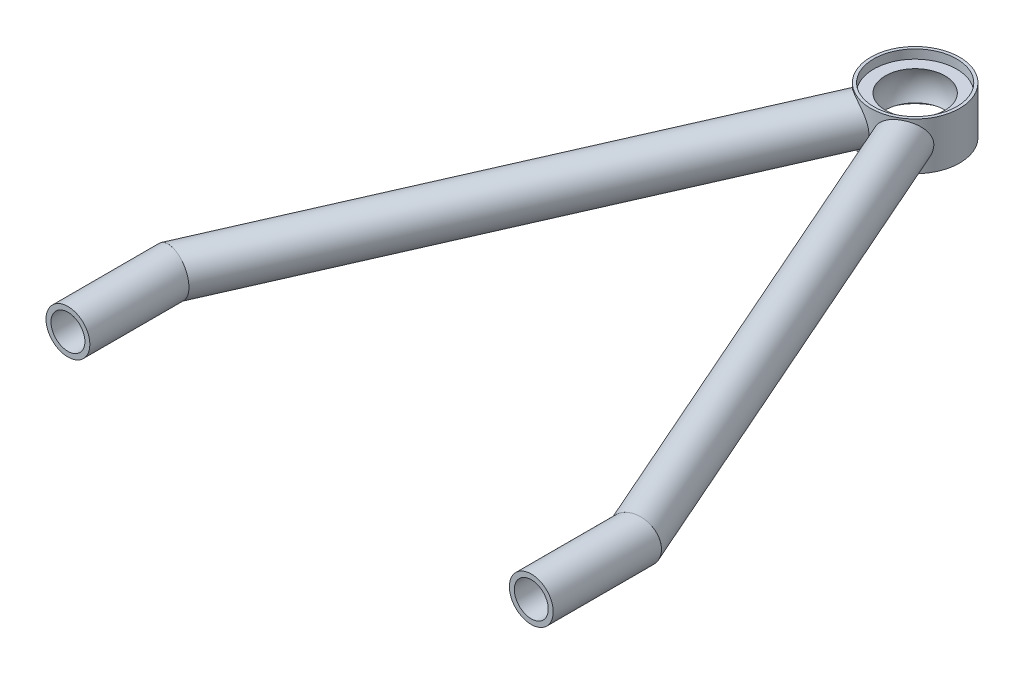
from build123d import *

# Parameters (mm, degrees)
SKETCH1_ON_SEGMENT_1_R                  = 7.4
SKETCH1_ON_SEGMENT_1_R_2                = 5.725
CIRCULAR_TUBE_21_3_X_2_3_1_DEPTH        = 38.202079732
CIRCULAR_TUBE_21_3_X_2_3_1_2_DEPTH      = 178.412650039
CIRCULAR_TUBE_21_3_X_2_3_1_2_DEPTH_BACK = 3.202079732
SKETCH1_R                               = 7.4
SKETCH1_R_2                             = 5.725
SKETCH11_ON_SEGMENT_1_R                 = 7.4
SKETCH11_ON_SEGMENT_1_R_2               = 5.725
CIRCULAR_TUBE_21_3_X_2_3_2_DEPTH        = 38.202079732
CIRCULAR_TUBE_21_3_X_2_3_2_2_DEPTH      = 178.412650039
CIRCULAR_TUBE_21_3_X_2_3_2_2_DEPTH_BACK = 3.202079732
SKETCH11_R                              = 7.4
SKETCH11_R_2                            = 5.725
SKETCH_1_R                              = 15
EXTRUDE_1_DEPTH                         = 8
SKETCH_5_R                              = 14
CUT_EXTRUDE_1_DEPTH                     = 3
SKETCH_7_R                              = 14
CUT_EXTRUDE_2_DEPTH                     = 3
WELD_START                              = -8
WELD_TRIM_4_DEPTH                       = 16
WELD_TRIM_4_2_DEPTH                     = 16


with BuildPart() as part:
    # Sketch1 on segment 1 (carried to segment 1) → Circular tube 21.3 X 2.3(1) (new body)
    with BuildSketch(Plane(origin=(-78.21449332, 0, 195.502886979), x_dir=(-1, 0, 0), z_dir=(0, 0, -1))):
        Circle(SKETCH1_ON_SEGMENT_1_R)
        Circle(SKETCH1_ON_SEGMENT_1_R_2, mode=Mode.SUBTRACT)
    extrude(amount=CIRCULAR_TUBE_21_3_X_2_3_1_DEPTH)

    # Circular tube 21.3 X 2.3(1) mitre 1
    split(bisect_by=Plane(origin=(-78.21449332, 0, 160.502886979), x_dir=(0, -1, 0), z_dir=(-0.205910543, 0, 0.978570819)), keep=Keep.TOP)


with BuildPart() as body_2:
    # Sketch1 → Circular tube 21.3 X 2.3_1 2 (new, two sides: drawn at the far end of the back side and taken through both)
    with BuildSketch(Plane(origin=(-78.21449332, 0, 160.502886979), x_dir=(-0.9152016968098962, 0, -0.4029960969491974), z_dir=(0.4029960969491974, 0, -0.9152016968098962)).offset(-CIRCULAR_TUBE_21_3_X_2_3_1_2_DEPTH_BACK)):
        Circle(SKETCH1_R)
        Circle(SKETCH1_R_2, mode=Mode.SUBTRACT)
    extrude(amount=CIRCULAR_TUBE_21_3_X_2_3_1_2_DEPTH + CIRCULAR_TUBE_21_3_X_2_3_1_2_DEPTH_BACK)

    # Circular tube 21.3 X 2.3_1 2 mitre 1
    split(bisect_by=Plane(origin=(-78.21449332, 0, 160.502886979), x_dir=(0, 1, 0), z_dir=(0.205910543, 0, -0.978570819)), keep=Keep.TOP)


with BuildPart() as body_3:
    # Sketch11 on segment 1 (carried to segment 1) → Circular tube 21.3 X 2.3(2) (new body)
    with BuildSketch(Plane(origin=(78.21449332, 0, 195.502886979), x_dir=(-1, 0, 0), z_dir=(0, 0, -1))):
        Circle(SKETCH11_ON_SEGMENT_1_R)
        Circle(SKETCH11_ON_SEGMENT_1_R_2, mode=Mode.SUBTRACT)
    extrude(amount=CIRCULAR_TUBE_21_3_X_2_3_2_DEPTH)

    # Circular tube 21.3 X 2.3(2) mitre 1
    split(bisect_by=Plane(origin=(78.21449332, 0, 160.502886979), x_dir=(0, -1, 0), z_dir=(0.205910543, 0, 0.978570819)), keep=Keep.TOP)


with BuildPart() as body_4:
    # Sketch11 → Circular tube 21.3 X 2.3_2 2 (new, two sides: drawn at the far end of the back side and taken through both)
    with BuildSketch(Plane(origin=(78.21449332, 0, 160.502886979), x_dir=(-0.9152016968098962, 0, 0.40299609694919775), z_dir=(-0.40299609694919775, 0, -0.9152016968098962)).offset(-CIRCULAR_TUBE_21_3_X_2_3_2_2_DEPTH_BACK)):
        Circle(SKETCH11_R)
        Circle(SKETCH11_R_2, mode=Mode.SUBTRACT)
    extrude(amount=CIRCULAR_TUBE_21_3_X_2_3_2_2_DEPTH + CIRCULAR_TUBE_21_3_X_2_3_2_2_DEPTH_BACK)

    # Circular tube 21.3 X 2.3_2 2 mitre 1
    split(bisect_by=Plane(origin=(78.21449332, 0, 160.502886979), x_dir=(0, 1, 0), z_dir=(-0.205910543, 0, -0.978570819)), keep=Keep.TOP)


with BuildPart() as body_5:
    # 스케치1 → 보스-돌출1 (new, symmetric)
    with BuildSketch(Plane(origin=(0, 0, 0), x_dir=(1, 0, 0), z_dir=(0, 1, 0))):
        with Locations(Location((0, 12.307113021, 0), (0, 0, 270))):
            Circle(SKETCH_1_R)
    extrude(amount=EXTRUDE_1_DEPTH, both=True)


with BuildPart() as cut_extrude_1_tool:
    # 스케치5 → 컷-돌출1 (new body)
    with BuildSketch(Plane(origin=(0, 8, 0), x_dir=(1, 0, 0), z_dir=(0, 1, 0))):
        with Locations(Location((0, 12.307113021, 0), (0, 0, 270))):
            Circle(SKETCH_5_R)
    extrude(amount=-CUT_EXTRUDE_1_DEPTH)


with BuildPart() as body_2_1:
    add(body_2.part)

    # 컷-돌출1: cut by cut_extrude_1_tool
    add(cut_extrude_1_tool.part, mode=Mode.SUBTRACT)


with BuildPart() as body_4_1:
    add(body_4.part)

    # 컷-돌출1: cut by cut_extrude_1_tool
    add(cut_extrude_1_tool.part, mode=Mode.SUBTRACT)


with BuildPart() as body_5_1:
    add(body_5.part)

    # 컷-돌출1: cut by cut_extrude_1_tool
    add(cut_extrude_1_tool.part, mode=Mode.SUBTRACT)


with BuildPart() as cut_extrude_2_tool:
    # 스케치7 → 컷-돌출2 (new body)
    with BuildSketch(Plane.XZ.offset(8)):
        with Locations(Location((0, -12.307113021, 0), (0, 0, 90))):
            Circle(SKETCH_7_R)
    extrude(amount=-CUT_EXTRUDE_2_DEPTH)


with BuildPart() as body_2_2:
    add(body_2_1.part)

    # 컷-돌출2: cut by cut_extrude_2_tool
    add(cut_extrude_2_tool.part, mode=Mode.SUBTRACT)

    # Weld Trim 4 2 outline → Weld Trim 4 2 (cut)
    with BuildSketch(Plane(origin=(0, 0, 0), x_dir=(1, 0, 0), z_dir=(0, 1, 0)).offset(WELD_START)):
        with BuildLine():
            ThreePointArc((-13.278559815, 5.330018407), (-8.02650701, -0.364713415), (-0.633551868, -2.679501408))
            Line((-0.633551868, -2.679501408), (2, -2.790833538))
            Line((2, -2.790833538), (2, -0.880671656))
            Line((2, -0.880671656), (0.457600848, -0.201498048))
            Line((0.457600848, -0.201498048), (-3.762869377, 1.656926203))
            Line((-3.762869377, 1.656926203), (-8.866914039, 3.904419935))
            Line((-8.866914039, 3.904419935), (-13.087384264, 5.762844186))
            Line((-13.087384264, 5.762844186), (-13.631989565, 6.002653412))
            Line((-13.631989565, 6.002653412), (-13.278559815, 5.330018407))
        make_face()
    extrude(amount=WELD_TRIM_4_2_DEPTH, mode=Mode.SUBTRACT)


with BuildPart() as body_4_2:
    add(body_4_1.part)

    # 컷-돌출2: cut by cut_extrude_2_tool
    add(cut_extrude_2_tool.part, mode=Mode.SUBTRACT)

    # Weld Trim 4: read off the stored shape, not the designer's step
    # Weld Trim 4 outline → Weld Trim 4 (cut)
    with BuildSketch(Plane(origin=(0, 0, 0), x_dir=(1, 0, 0), z_dir=(0, 1, 0)).offset(WELD_START)):
        with BuildLine():
            ThreePointArc((0.632975611, -2.679525758), (8.025973922, -0.365051065), (13.278241052, 5.329411783))
            Line((13.278241052, 5.329411783), (13.632040607, 6.002675888))
            Line((13.632040607, 6.002675888), (13.087384264, 5.762844186))
            Line((13.087384264, 5.762844186), (8.866914039, 3.904419935))
            Line((8.866914039, 3.904419935), (3.762869377, 1.656926203))
            Line((3.762869377, 1.656926203), (-0.457600848, -0.201498048))
            Line((-0.457600848, -0.201498048), (-2, -0.880671656))
            Line((-2, -0.880671656), (-2, -2.790732104))
            Line((-2, -2.790732104), (0.632975611, -2.679525758))
        make_face()
    extrude(amount=WELD_TRIM_4_DEPTH, mode=Mode.SUBTRACT)


with BuildPart() as body_5_2:
    add(body_5_1.part)

    # 컷-돌출2: cut by cut_extrude_2_tool
    add(cut_extrude_2_tool.part, mode=Mode.SUBTRACT)

    # 스케치9 → 컷-회전1 (revolve, cut)
    with BuildSketch(Plane(origin=(0, 0, 0), x_dir=(0, 0, -1), z_dir=(1, 0, 0))):
        with BuildLine():
            Line((12.307113021, -11.25), (12.307113021, 11.25))
            ThreePointArc((12.307113021, 11.25), (23.557113021, 0), (12.307113021, -11.25))
        make_face()
    revolve(axis=Axis((0, 8, -12.307113021), (0, -1, 0)), mode=Mode.SUBTRACT)


solid = Compound([part.part, body_3.part, body_2_2.part, body_4_2.part, body_5_2.part])
